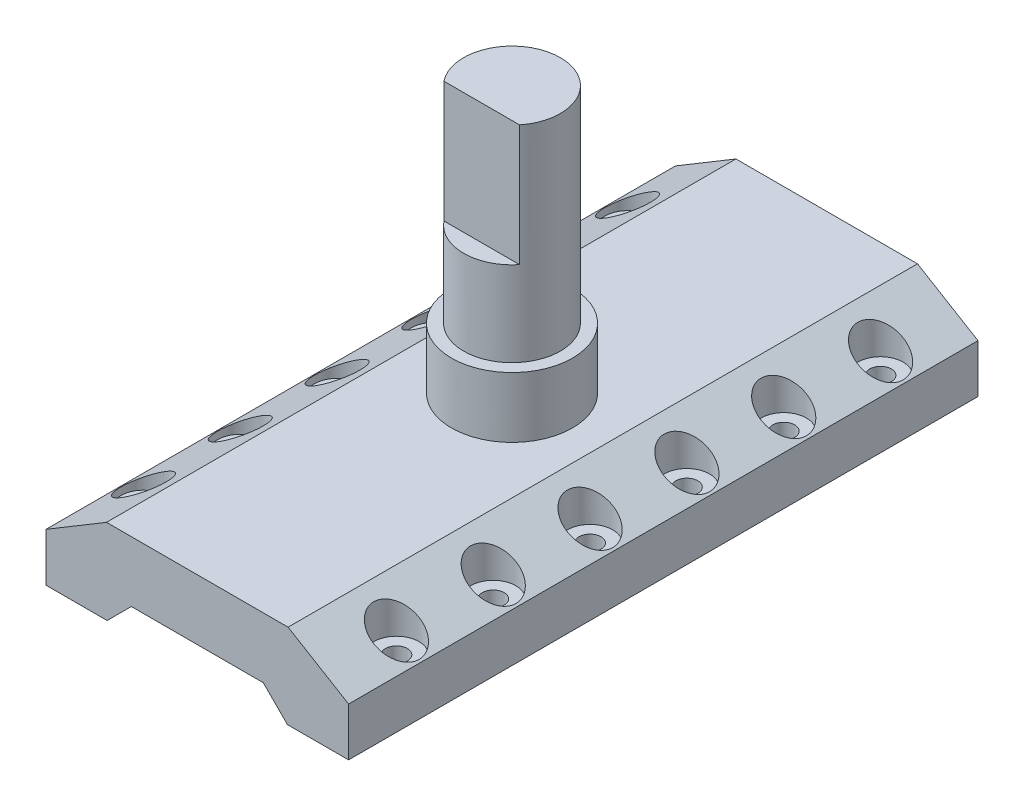
from build123d import *

# Parameters (mm, degrees)
SKETCH1_W           = 25
SKETCH1_H           = 52
BOSS_EXTRUDE1_DEPTH = 7
SKETCH2_R           = 0.9
CUT_EXTRUDE1_DEPTH  = 30.685855218
LPATTERN1_COUNT     = 6
LPATTERN1_PITCH     = 8
SKETCH5_R           = 4
BOSS_EXTRUDE2_DEPTH = 22
SKETCH6_R           = 5
SKETCH6_R_2         = 4
BOSS_EXTRUDE3_DEPTH = 5
CUT_EXTRUDE2_START  = -10
CUT_EXTRUDE2_DEPTH  = 10
SKETCH9_R           = 1.875
CUT_EXTRUDE3_DEPTH  = 3.5
LPATTERN2_COUNT     = 6
LPATTERN2_PITCH     = 8
CHAMFER2_SIZE       = 3
CHAMFER2_SIZE_2     = 5
SKETCH10_W          = 14.9
SKETCH10_H          = 52
CUT_EXTRUDE4_DEPTH  = 2
CHAMFER3_SIZE       = 2


# Some blends are built 0.0001 mm under size
with BuildPart() as part:
    # Sketch1 → Boss-Extrude1 (new body)
    with BuildSketch(Plane(origin=(0, 0, 0), x_dir=(1, 0, 0), z_dir=(0, 1, 0))):
        Rectangle(SKETCH1_W, SKETCH1_H)
    extrude(amount=BOSS_EXTRUDE1_DEPTH)

    # Sketch2 → Cut-Extrude1 (cut, through all)
    with BuildSketch(Plane(origin=(0, 7, 0), x_dir=(1, 0, 0), z_dir=(0, 1, 0))):
        with Locations(Location((-10.45, -20, 0), (0, 0, 270))):
            Circle(SKETCH2_R)
        with Locations(Location((10.45, -20, 0), (0, 0, 270))):
            Circle(SKETCH2_R)
    cut_extrude1 = extrude(amount=-CUT_EXTRUDE1_DEPTH, mode=Mode.SUBTRACT)

    # LPattern1: Cut-Extrude1 ×6
    with Locations(*[(0, 0, -i * LPATTERN1_PITCH) for i in range(1, LPATTERN1_COUNT)]):
        add(cut_extrude1, mode=Mode.SUBTRACT)

    # Sketch5 → Boss-Extrude2 (add)
    with BuildSketch(Plane(origin=(0, 7, 0), x_dir=(1, 0, 0), z_dir=(0, 1, 0))):
        with Locations(Location((0, 0, 0), (0, 0, 90))):
            Circle(SKETCH5_R)
    extrude(amount=BOSS_EXTRUDE2_DEPTH)

    # Sketch6 → Boss-Extrude3 (add)
    with BuildSketch(Plane(origin=(0, 7, 0), x_dir=(1, 0, 0), z_dir=(0, 1, 0))):
        with Locations(Location((0, 0, 0), (0, 0, 90))):
            Circle(SKETCH6_R)
        with Locations(Location((0, 0, 0), (0, 0, 270))):
            Circle(SKETCH6_R_2, mode=Mode.SUBTRACT)
    extrude(amount=BOSS_EXTRUDE3_DEPTH)

    # Sketch8 → Cut-Extrude2 (cut)
    with BuildSketch(Plane(origin=(0, 29, 0), x_dir=(1, 0, 0), z_dir=(0, 1, 0)).offset(CUT_EXTRUDE2_START)):
        with BuildLine():
            Line((-3.122498999, -2.5), (3.122498999, -2.5))
            ThreePointArc((3.122498999, -2.5), (0, -4), (-3.122498999, -2.5))
        make_face()
    extrude(amount=CUT_EXTRUDE2_DEPTH, mode=Mode.SUBTRACT)

    # Sketch9 → Cut-Extrude3 (cut)
    with BuildSketch(Plane(origin=(0, 7, 0), x_dir=(1, 0, 0), z_dir=(0, 1, 0))):
        with Locations(Location((-10.45, 20, 0), (0, 0, 270))):
            Circle(SKETCH9_R)
        with Locations(Location((10.45, 20, 0), (0, 0, 270))):
            Circle(SKETCH9_R)
    cut_extrude3 = extrude(amount=-CUT_EXTRUDE3_DEPTH, mode=Mode.SUBTRACT)

    # LPattern2: Cut-Extrude3 ×6
    with Locations(*[(0, 0, i * LPATTERN2_PITCH) for i in range(1, LPATTERN2_COUNT)]):
        add(cut_extrude3, mode=Mode.SUBTRACT)

    # Chamfer2
    # the kernel refuses this chamfer: 5, 3 mm, written as the material it takes off along each edge
    with BuildSketch(Plane(origin=(-12.5, 7, -38.931305486), x_dir=(-0.0551862070597658, -0.9984760801092616, 0), z_dir=(0, 0, 1)), Plane(origin=(12.5, 7, 38.931305486), x_dir=(0.0551862070597658, -0.9984760801092616, 0), z_dir=(0, 0, -1))) as chamfer2_piece_1:
        Polygon((CHAMFER2_SIZE * 0.998476080109, CHAMFER2_SIZE * 0.0551862070598), (-CHAMFER2_SIZE_2 * 0.0551862070598, CHAMFER2_SIZE_2 * 0.998476080109), (0, 0), align=None)
    extrude(amount=77.862610972, mode=Mode.SUBTRACT)

    # Sketch10 → Cut-Extrude4 (cut)
    with BuildSketch(Plane.XZ):
        Rectangle(SKETCH10_W, SKETCH10_H)
    extrude(amount=-CUT_EXTRUDE4_DEPTH, mode=Mode.SUBTRACT)

    # Chamfer3
    chamfer3_edges = [part.edges().sort_by_distance(p)[0] for p in [
        (7.45, 2, 0),
        (-7.45, 2, 0),
    ]]
    chamfer(chamfer3_edges, length=CHAMFER3_SIZE - 0.0001)  # a hair under: the kernel refuses the full size


solid = part.part
